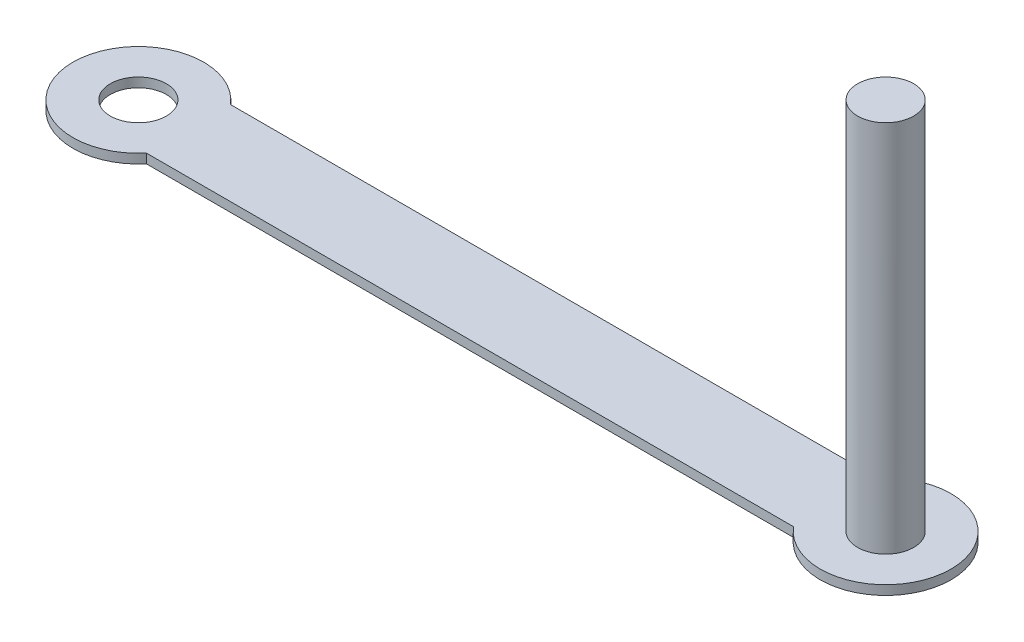
from build123d import *

# Parameters (mm, degrees)
SKETCH1_R           = 9.525
BOSS_EXTRUDE1_DEPTH = 3.175
SKETCH2_R           = 9.525
BOSS_EXTRUDE2_DEPTH = 127


with BuildPart() as part:
    # Sketch1 → Boss-Extrude1 (new body)
    with BuildSketch(Plane(origin=(0, 0, 0), x_dir=(1, 0, 0), z_dir=(0, 1, 0))):
        with BuildLine():
            Line((109.975959095, 14.2875), (-109.975959095, 14.2875))
            ThreePointArc((-109.975959095, 14.2875), (-149.225, 0), (-109.975959095, -14.2875))
            Line((-109.975959095, -14.2875), (109.975959095, -14.2875))
            ThreePointArc((109.975959095, -14.2875), (149.225, 0), (109.975959095, 14.2875))
        make_face()
        with Locations((-127, 0)):
            Circle(SKETCH1_R, mode=Mode.SUBTRACT)
    extrude(amount=BOSS_EXTRUDE1_DEPTH)

    # Sketch2 → Boss-Extrude2 (add)
    with BuildSketch(Plane(origin=(0, 3.175, 0), x_dir=(1, 0, 0), z_dir=(0, 1, 0))):
        with Locations((127, 0)):
            Circle(SKETCH2_R)
    extrude(amount=BOSS_EXTRUDE2_DEPTH)


solid = part.part
